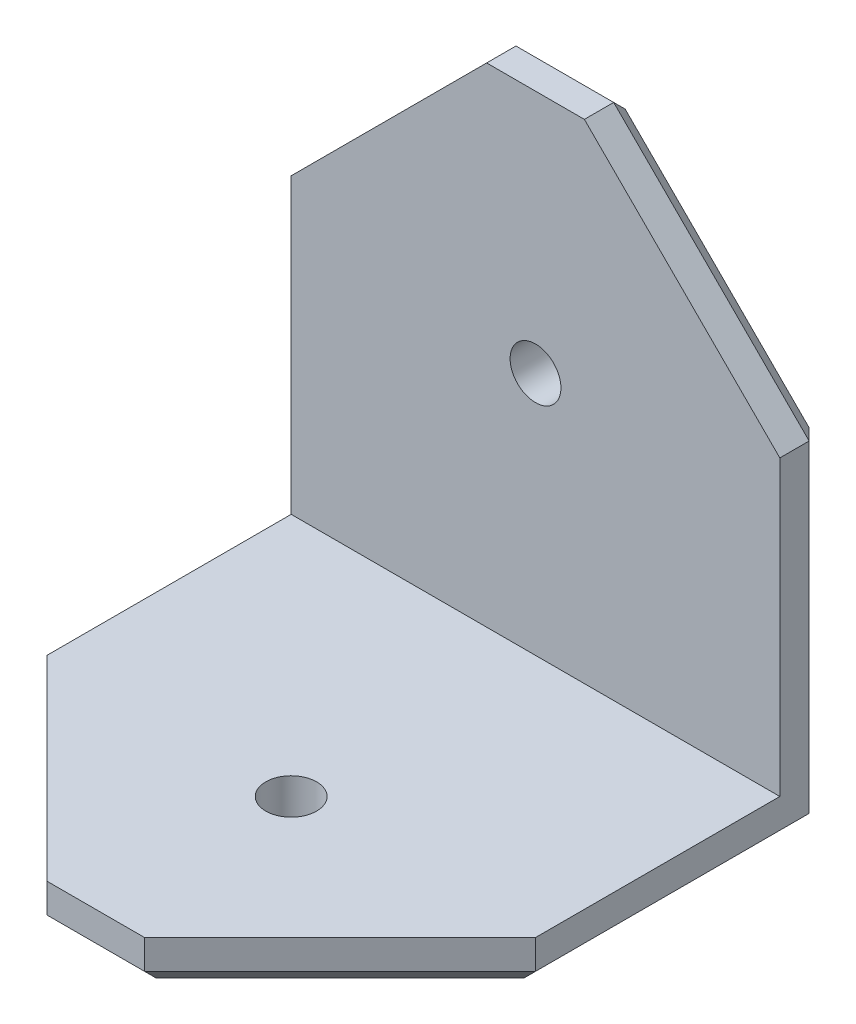
from build123d import *

# Parameters (mm, degrees)
SKETCH1_W           = 50
SKETCH1_H           = 50
BOSS_EXTRUDE1_DEPTH = 5
SKETCH2_W           = 50
SKETCH2_H           = 5
BOSS_EXTRUDE2_DEPTH = 50
SKETCH3_R           = 2.6
CUT_EXTRUDE1_DEPTH  = 50
CHAMFER1_SIZE       = 20
SKETCH4_R           = 2.6
CUT_EXTRUDE2_DEPTH  = 50
CHAMFER2_SIZE       = 20
CHAMFER3_SIZE       = 2
CHAMFER4_SIZE       = 2


with BuildPart() as part:
    # Sketch1 → Boss-Extrude1 (new body)
    with BuildSketch(Plane(origin=(0, 0, 0), x_dir=(1, 0, 0), z_dir=(0, 1, 0))):
        Rectangle(SKETCH1_W, SKETCH1_H)
    extrude(amount=BOSS_EXTRUDE1_DEPTH)

    # Sketch2 → Boss-Extrude2 (add)
    with BuildSketch(Plane(origin=(0, 5, 0), x_dir=(1, 0, 0), z_dir=(0, 1, 0))):
        with Locations((0, 22.5)):
            Rectangle(SKETCH2_W, SKETCH2_H)
    extrude(amount=BOSS_EXTRUDE2_DEPTH)

    # Sketch3 → Cut-Extrude1 (cut)
    with BuildSketch(Plane.XY.offset(-20)):
        with Locations((0, 30)):
            Circle(SKETCH3_R)
    extrude(amount=-CUT_EXTRUDE1_DEPTH, mode=Mode.SUBTRACT)

    # Chamfer1
    chamfer1_edges = [part.edges().sort_by_distance(p)[0] for p in [
        (25, 55, -22.5),
        (-25, 55, -22.5),
    ]]
    chamfer(chamfer1_edges, length=CHAMFER1_SIZE)

    # Sketch4 → Cut-Extrude2 (cut)
    with BuildSketch(Plane(origin=(0, 5, 0), x_dir=(1, 0, 0), z_dir=(0, 1, 0))):
        with Locations(Location((0, -5, 0), (0, 0, 270))):
            Circle(SKETCH4_R)
    extrude(amount=-CUT_EXTRUDE2_DEPTH, mode=Mode.SUBTRACT)

    # Chamfer2
    chamfer2_edges = [part.edges().sort_by_distance(p)[0] for p in [
        (25, 2.5, 25),
        (-25, 2.5, 25),
    ]]
    chamfer(chamfer2_edges, length=CHAMFER2_SIZE)

    # Chamfer3
    chamfer3_edges = [part.edges().sort_by_distance(p)[0] for p in [
        (0, 0, -25),
    ]]
    chamfer(chamfer3_edges, length=CHAMFER3_SIZE)

    # Chamfer4
    # the kernel refuses this chamfer: 2 mm, written as the material it takes off along each edge
    with BuildSketch(Plane(origin=(25, 0, -28.143365976), x_dir=(-0.9996219169112968, -0.02749587661058639, 0), z_dir=(0, 0, 1))) as chamfer4_piece_1:
        Polygon((CHAMFER4_SIZE * 0.999621916911, -CHAMFER4_SIZE * 0.0274958766106), (-CHAMFER4_SIZE * 0.0274958766106, -CHAMFER4_SIZE * 0.999621916911), (0, 0), align=None)
    extrude(amount=38.286731952, mode=Mode.SUBTRACT)
    with BuildSketch(Plane(origin=(28.63690896, 0, 1.36309104), x_dir=(-0.7068394360706735, -0.027495876610586382, -0.7068394360706735), z_dir=(-0.7071067811865475, 0, 0.7071067811865476)), Plane(origin=(1.36309104, 58.63690896, -25), x_dir=(-0.7068394360706736, -0.7068394360706737, -0.027495876610585657), z_dir=(0.7071067811865476, -0.7071067811865476, 0)), Plane(origin=(-28.63690896, 31.36309104, -25), x_dir=(0.7068394360706735, -0.7068394360706735, -0.02749587661058563), z_dir=(0.7071067811865476, 0.7071067811865476, 0))) as chamfer4_piece_2:
        Polygon((CHAMFER4_SIZE * 0.999621916911, -CHAMFER4_SIZE * 0.0274958766106), (-CHAMFER4_SIZE * 0.0274958766106, -CHAMFER4_SIZE * 0.999621916911), (0, 0), align=None)
    extrude(amount=38.571003199, mode=Mode.SUBTRACT)
    with BuildSketch(Plane(origin=(10.143365976, 0, 25), x_dir=(0, -0.02749587661058639, -0.9996219169112968), z_dir=(-1, 0, 0))) as chamfer4_piece_3:
        Polygon((CHAMFER4_SIZE * 0.999621916911, -CHAMFER4_SIZE * 0.0274958766106), (-CHAMFER4_SIZE * 0.0274958766106, -CHAMFER4_SIZE * 0.999621916911), (0, 0), align=None)
    extrude(amount=20.286731952, mode=Mode.SUBTRACT)
    with BuildSketch(Plane(origin=(-28.63690896, 0, 1.36309104), x_dir=(0.7068394360706733, -0.027495876610586358, -0.7068394360706735), z_dir=(0.7071067811865476, 0, 0.7071067811865475))) as chamfer4_piece_4:
        Polygon((CHAMFER4_SIZE * 0.999621916911, CHAMFER4_SIZE * 0.0274958766106), (-CHAMFER4_SIZE * 0.0274958766106, CHAMFER4_SIZE * 0.999621916911), (0, 0), align=None)
    extrude(amount=38.571003199, mode=Mode.SUBTRACT)
    with BuildSketch(Plane(origin=(-25, 0, 10.143365976), x_dir=(-0.02749587661058563, 0.9996219169112968, 0), z_dir=(0, 0, -1))) as chamfer4_piece_5:
        Polygon((CHAMFER4_SIZE * 0.999621916911, CHAMFER4_SIZE * 0.0274958766106), (-CHAMFER4_SIZE * 0.0274958766106, CHAMFER4_SIZE * 0.999621916911), (0, 0), align=None)
    extrude(amount=38.286731952, mode=Mode.SUBTRACT)
    with BuildSketch(Plane(origin=(25, 40.143365976, -25), x_dir=(-0.9996219169112968, 0, -0.027495876610585647), z_dir=(0, -1, 0))) as chamfer4_piece_6:
        Polygon((CHAMFER4_SIZE * 0.999621916911, -CHAMFER4_SIZE * 0.0274958766106), (-CHAMFER4_SIZE * 0.0274958766106, -CHAMFER4_SIZE * 0.999621916911), (0, 0), align=None)
    extrude(amount=43.286731952, mode=Mode.SUBTRACT)
    with BuildSketch(Plane(origin=(10.143365976, 55, -25), x_dir=(0, -0.9996219169112968, -0.027495876610585647), z_dir=(-1, 0, 0))) as chamfer4_piece_7:
        Polygon((CHAMFER4_SIZE * 0.999621916911, CHAMFER4_SIZE * 0.0274958766106), (-CHAMFER4_SIZE * 0.0274958766106, CHAMFER4_SIZE * 0.999621916911), (0, 0), align=None)
    extrude(amount=20.286731952, mode=Mode.SUBTRACT)
    with BuildSketch(Plane(origin=(-25, -3.143365976, -25), x_dir=(-0.027495876610585647, 0, 0.9996219169112968), z_dir=(0, 1, 0))) as chamfer4_piece_8:
        Polygon((CHAMFER4_SIZE * 0.999621916911, CHAMFER4_SIZE * 0.0274958766106), (-CHAMFER4_SIZE * 0.0274958766106, CHAMFER4_SIZE * 0.999621916911), (0, 0), align=None)
    extrude(amount=43.286731952, mode=Mode.SUBTRACT)


solid = part.part
